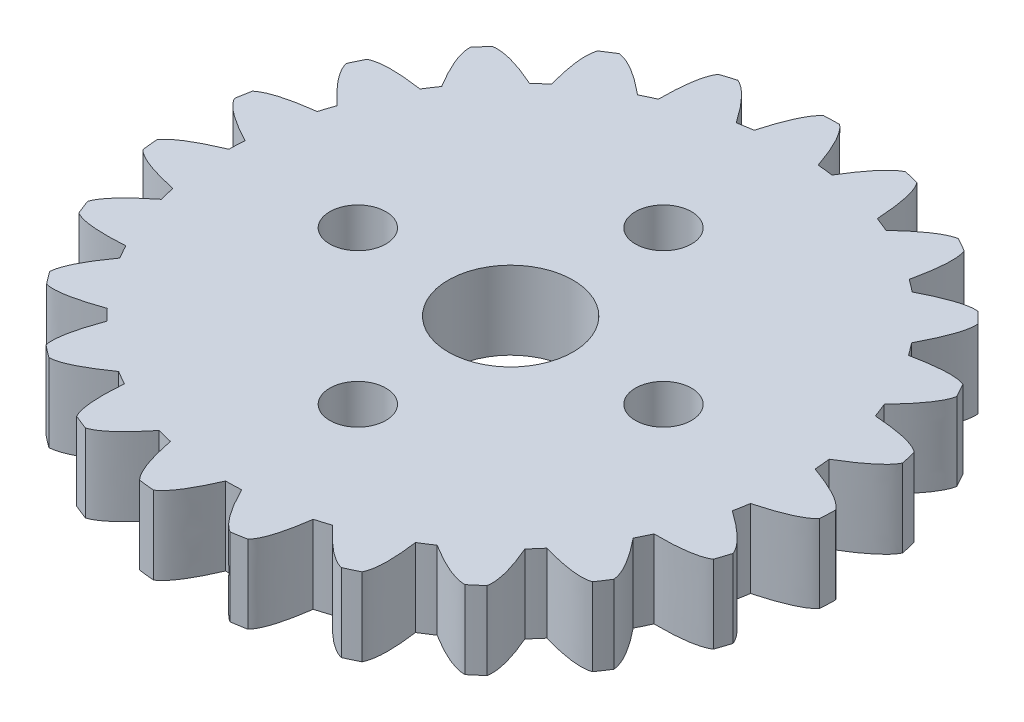
from build123d import *

# Parameters (mm, degrees)
BOSS_EXTRUDE4_DEPTH = 5
CIRPATTERN6_COUNT   = 23
SKETCH2_R           = 4
CUT_EXTRUDE1_DEPTH  = 10
SKETCH5_R           = 1.8
CUT_EXTRUDE2_DEPTH  = 10
CIRPATTERN7_COUNT   = 4


with BuildPart() as part:
    # Sketch1 → Boss-Extrude4 (new body)
    with BuildSketch(Plane(origin=(0, 0, 0), x_dir=(1, 0, 0), z_dir=(0, 1, 0))):
        with BuildLine():
            ThreePointArc((15.419368848, 14.540084225), (15.072047997, 14.89981054), (14.716337163, 15.251242751))
            add(Edge.make_bspline(
                [(14.716337163, 15.251242751), (13.763926874, 15.361536707), (11.53530557, 14.210203687)],
                knots=[0.625249108, 0.625249108, 0.625249108, 1, 1, 1], degree=2))
            ThreePointArc((11.53530557, 14.210203687), (-13.016205398, -12.867461305), (14.341839266, 11.371227282))
            add(Edge.make_bspline(
                [(14.341839266, 11.371227282), (15.518709564, 13.586469241), (15.419368848, 14.540084225)],
                knots=[0, 0, 0, 0.374750892, 0.374750892, 0.374750892], degree=2))
        make_face()
    boss_extrude4 = extrude(amount=BOSS_EXTRUDE4_DEPTH)

    # CirPattern6: Boss-Extrude4 ×23 about axis
    cirpattern6_axis = Axis((0, 5, 0), (0, 1, 0))
    for i in range(1, CIRPATTERN6_COUNT):
        add(boss_extrude4.rotate(cirpattern6_axis, i * 360 / CIRPATTERN6_COUNT))

    # Sketch2 → Cut-Extrude1 (cut)
    with BuildSketch(Plane(origin=(0, 5, 0), x_dir=(1, 0, 0), z_dir=(0, 1, 0))):
        Circle(SKETCH2_R)
    extrude(amount=-CUT_EXTRUDE1_DEPTH, mode=Mode.SUBTRACT)

    # Sketch5 → Cut-Extrude2 (cut)
    with BuildSketch(Plane(origin=(0, 5, 0), x_dir=(1, 0, 0), z_dir=(0, 1, 0))):
        with Locations((9.8, 0)):
            Circle(SKETCH5_R)
    cut_extrude2 = extrude(amount=-CUT_EXTRUDE2_DEPTH, mode=Mode.SUBTRACT)

    # CirPattern7: Cut-Extrude2 ×4 about axis
    cirpattern7_axis = Axis((0, 5, 0), (0, 1, 0))
    for i in range(1, CIRPATTERN7_COUNT):
        add(cut_extrude2.rotate(cirpattern7_axis, i * 360 / CIRPATTERN7_COUNT), mode=Mode.SUBTRACT)


solid = part.part
